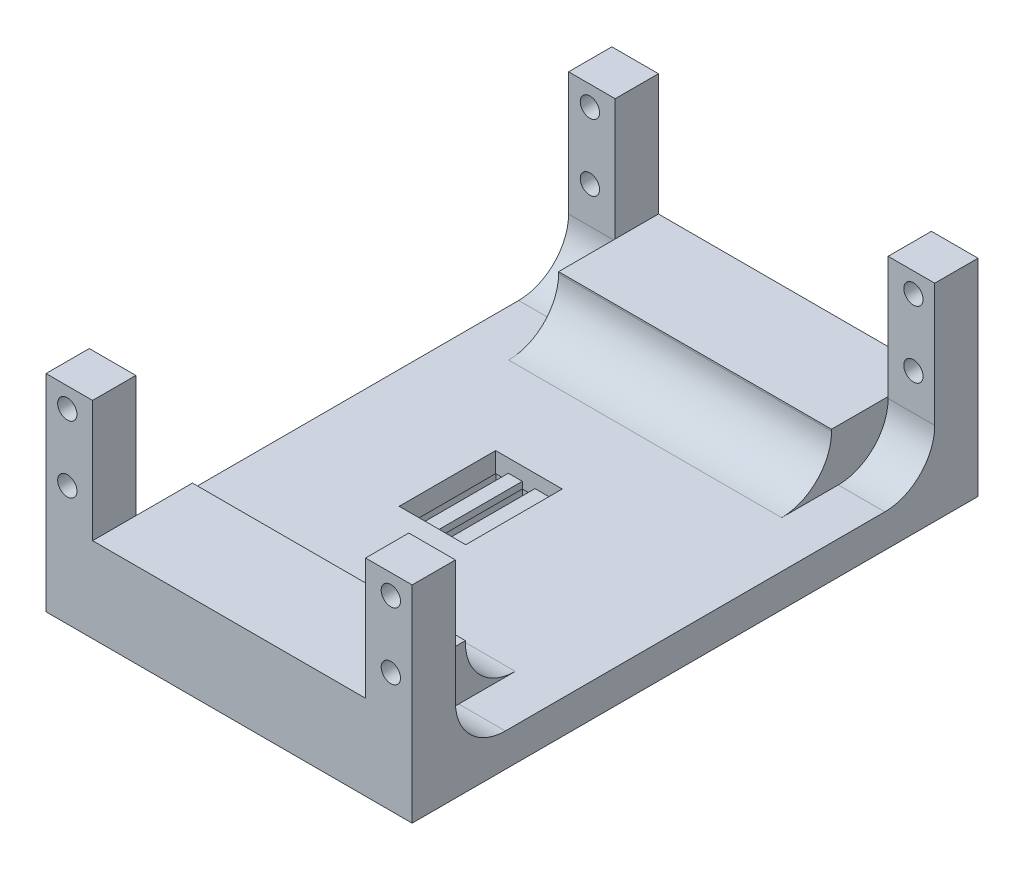
from build123d import *

# Parameters (mm, degrees)
SKETCH_1_W          = 55
SKETCH_1_H          = 85
EXTRUDE_1_DEPTH     = 5
SKETCH_2_W          = 7
SKETCH_2_H          = 6.5
EXTRUDE_2_DEPTH     = 26
SKETCH_3_R          = 1.45
CUT_EXTRUDE_1_DEPTH = 103.30377559
SKETCH_4_W          = 41
SKETCH_4_H          = 15
EXTRUDE_3_DEPTH     = 7.75
SKETCH_5_W          = 24.5
SKETCH_5_H          = 49.5
EXTRUDE_4_DEPTH     = 10
SKETCH_7_R          = 2.525
CUT_EXTRUDE_2_DEPTH = 2.25
SKETCH_8_W          = 2.7
SKETCH_8_H          = 15.4
CUT_EXTRUDE_3_DEPTH = 12
SKETCH_9_W          = 1.9
SKETCH_9_H          = 14.5
CUT_EXTRUDE_4_DEPTH = 1
SKETCH_10_W         = 10
SKETCH_10_H         = 14.5
CUT_EXTRUDE_5_DEPTH = 70.787624261
FILLET_1_R          = 3
FILLET_2_R          = 7.5


with BuildPart() as part:
    # Эскиз1 → Бобышка-Вытянуть1 (new body)
    with BuildSketch(Plane(origin=(0, 0, 0), x_dir=(1, 0, 0), z_dir=(0, 1, 0))):
        with Locations((-20.25, 0)):
            Rectangle(SKETCH_1_W, SKETCH_1_H)
    extrude(amount=EXTRUDE_1_DEPTH)

    # Эскиз2 → Бобышка-Вытянуть2 (add)
    with BuildSketch(Plane(origin=(0, 5, 0), x_dir=(1, 0, 0), z_dir=(0, 1, 0))):
        with Locations((-44.25, 39.25)):
            Rectangle(SKETCH_2_W, SKETCH_2_H)
        with Locations((3.75, 39.25)):
            Rectangle(SKETCH_2_W, SKETCH_2_H)
        with Locations((3.75, -39.25)):
            Rectangle(SKETCH_2_W, SKETCH_2_H)
        with Locations((-44.25, -39.25)):
            Rectangle(SKETCH_2_W, SKETCH_2_H)
    extrude(amount=EXTRUDE_2_DEPTH)

    # Эскиз3 → Вырез-Вытянуть1 (cut, through all)
    with BuildSketch(Plane.XY.offset(42.5)):
        with Locations((-44.55, 28)):
            Circle(SKETCH_3_R)
        with Locations((-44.55, 18)):
            Circle(SKETCH_3_R)
        with Locations((4.05, 18)):
            Circle(SKETCH_3_R)
        with Locations((4.05, 28)):
            Circle(SKETCH_3_R)
    extrude(amount=-CUT_EXTRUDE_1_DEPTH, mode=Mode.SUBTRACT)

    # Эскиз4 → Бобышка-Вытянуть3 (add)
    with BuildSketch(Plane(origin=(0, 5, 0), x_dir=(1, 0, 0), z_dir=(0, 1, 0))):
        with Locations((-20.25, 35)):
            Rectangle(SKETCH_4_W, SKETCH_4_H)
        with Locations((-20.25, -35)):
            Rectangle(SKETCH_4_W, SKETCH_4_H)
    extrude(amount=EXTRUDE_3_DEPTH)

    # Эскиз5 → Бобышка-Вытянуть4 (add)
    with BuildSketch(Plane.XZ):
        with Locations((-20.25, 0)):
            Rectangle(SKETCH_5_W, SKETCH_5_H)
    extrude(amount=EXTRUDE_4_DEPTH)

    # Эскиз7 → Вырез-Вытянуть2 (cut)
    with BuildSketch(Plane.XZ.offset(10)):
        with Locations((-13, 20)):
            Circle(SKETCH_7_R)
        with Locations((-13, -20)):
            Circle(SKETCH_7_R)
    extrude(amount=-CUT_EXTRUDE_2_DEPTH, mode=Mode.SUBTRACT)

    # Эскиз8 → Вырез-Вытянуть3 (cut)
    with BuildSketch(Plane.XZ.offset(10)):
        with Locations((-29, 0)):
            Rectangle(SKETCH_8_W, SKETCH_8_H)
        with Locations((-25, 0)):
            Rectangle(SKETCH_8_W, SKETCH_8_H)
    extrude(amount=-CUT_EXTRUDE_3_DEPTH, mode=Mode.SUBTRACT)

    # Эскиз9 → Вырез-Вытянуть4 (cut)
    with BuildSketch(Plane.XZ.offset(-2)):
        with Locations((-29, 0)):
            Rectangle(SKETCH_9_W, SKETCH_9_H)
        with Locations((-25, 0)):
            Rectangle(SKETCH_9_W, SKETCH_9_H)
    extrude(amount=-CUT_EXTRUDE_4_DEPTH, mode=Mode.SUBTRACT)

    # Эскиз10 → Вырез-Вытянуть5 (cut, through all)
    with BuildSketch(Plane.XZ.offset(-3)):
        with Locations((-24.95, 0)):
            Rectangle(SKETCH_10_W, SKETCH_10_H)
    extrude(amount=-CUT_EXTRUDE_5_DEPTH, mode=Mode.SUBTRACT)

    # Скругление1
    fillet_1_edges = [part.edges().sort_by_distance(p)[0] for p in [
        (-8, -5, 24.75),
        (-8, -5, -24.75),
        (-32.5, -5, -24.75),
        (-32.5, -5, 24.75),
    ]]
    fillet(fillet_1_edges, radius=FILLET_1_R)

    # Скругление2
    fillet_2_edges = [part.edges().sort_by_distance(p)[0] for p in [
        (-44.25, 5, -36),
        (3.75, 5, -36),
        (-20.25, 5, -27.5),
        (3.75, 5, 36),
        (-44.25, 5, 36),
        (-20.25, 5, 27.5),
    ]]
    fillet(fillet_2_edges, radius=FILLET_2_R)


solid = part.part
